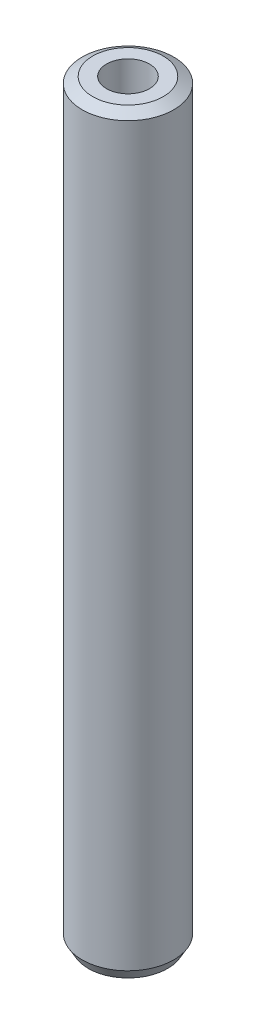
from build123d import *
from OCP.BRepFilletAPI import BRepFilletAPI_MakeChamfer

# Parameters (mm, degrees)
SKETCH1_R           = 10
BOSS_EXTRUDE1_DEPTH = 164.48272629
SKETCH2_R           = 4.685980634
CUT_EXTRUDE1_DEPTH  = 166.089573408
CHAMFER1_SIZE       = 1.329123507
CHAMFER1_SIZE2      = 2.302109443


with BuildPart() as part:
    # Sketch1 → Boss-Extrude1 (new body)
    with BuildSketch(Plane(origin=(0, 0, 0), x_dir=(1, 0, 0), z_dir=(0, 1, 0))):
        Circle(SKETCH1_R)
    extrude(amount=BOSS_EXTRUDE1_DEPTH)

    # Sketch2 → Cut-Extrude1 (cut, through all)
    with BuildSketch(Plane(origin=(0, 0, 0), x_dir=(1, 0, 0), z_dir=(0, 1, 0))):
        Circle(SKETCH2_R)
    extrude(amount=CUT_EXTRUDE1_DEPTH, mode=Mode.SUBTRACT)

    # Chamfer1: one chamfer whose edges measure the first distance from different faces: ONE call of the kernel's chamfer builder (chamfer() names one face for all edges)
    chamfer1_edges_1 = [part.edges().sort_by_distance(p)[0] for p in [
        (-10, 164.48272629, 0),
    ]]
    chamfer1_side_1 = [part.faces().sort_by_distance(p)[0] for p in [
        (-10, 82.241363145, 0),
    ]]
    chamfer1_edges_2 = [part.edges().sort_by_distance(p)[0] for p in [
        (-10, 0, 0),
    ]]
    chamfer1_side_2 = [part.faces().sort_by_distance(p)[0] for p in [
        (-9.717157288, 0, 0),
    ]]
    chamfer1 = BRepFilletAPI_MakeChamfer(part.part.solid().wrapped)
    for e in chamfer1_edges_1:
        chamfer1.Add(CHAMFER1_SIZE, CHAMFER1_SIZE2, e.wrapped, chamfer1_side_1[0].wrapped)  # the first distance lies on this face
    for e in chamfer1_edges_2:
        chamfer1.Add(CHAMFER1_SIZE, CHAMFER1_SIZE2, e.wrapped, chamfer1_side_2[0].wrapped)  # the first distance lies on this face
    add(Compound.cast(chamfer1.Shape()), mode=Mode.REPLACE)


solid = part.part
